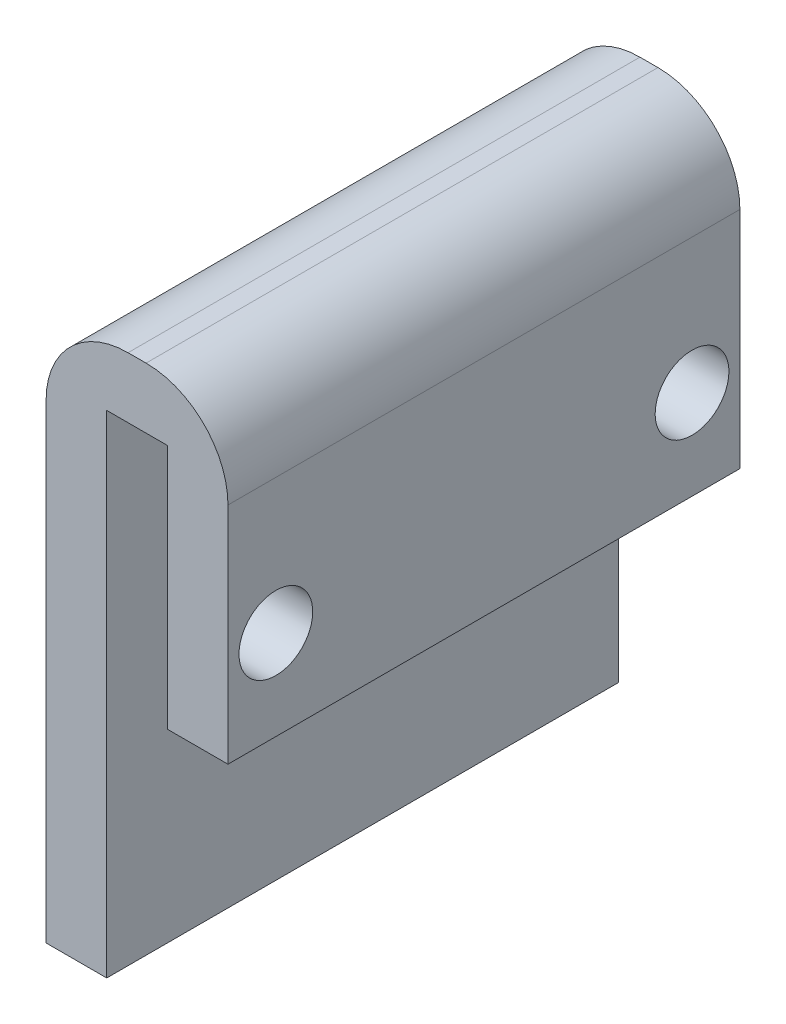
from build123d import *

# Parameters (mm, degrees)
BOSS_EXTRUDE1_DEPTH = 31.242
FILLET1_R           = 5
CUT_EXTRUDE1_REACH  = 49.275
SKETCH2_R           = 2.25


with BuildPart() as part:
    # Sketch1 → Boss-Extrude1 (new body)
    with BuildSketch(Plane.XY):
        Polygon((0, 0), (0, 30), (3.7, 30), (3.7, 15), (7.4, 15), (7.4, 33.7), (-3.7, 33.7), (-3.7, 0), align=None)
    extrude(amount=BOSS_EXTRUDE1_DEPTH)

    # Fillet1
    fillet1_edges = [part.edges().sort_by_distance(p)[0] for p in [
        (7.4, 33.7, 15.621),
        (-3.7, 33.7, 15.621),
    ]]
    fillet(fillet1_edges, radius=FILLET1_R)

    # Sketch2 → Cut-Extrude1 (cut, up to next)
    with BuildSketch(Plane(origin=(7.4, 0, 0), x_dir=(0, 0, -1), z_dir=(1, 0, 0)), mode=Mode.PRIVATE) as cut_extrude1_sk1:
        with Locations((-28.321, 20.475)):
            Circle(SKETCH2_R)
    cut_extrude1_tool1 = extrude(cut_extrude1_sk1.sketch, amount=-CUT_EXTRUDE1_REACH, mode=Mode.PRIVATE) & part.part
    # Sketch2 → Cut-Extrude1 (cut, up to next)
    with BuildSketch(Plane(origin=(7.4, 0, 0), x_dir=(0, 0, -1), z_dir=(1, 0, 0)), mode=Mode.PRIVATE) as cut_extrude1_sk2:
        with Locations((-2.921, 20.475)):
            Circle(SKETCH2_R)
    cut_extrude1_tool2 = extrude(cut_extrude1_sk2.sketch, amount=-CUT_EXTRUDE1_REACH, mode=Mode.PRIVATE) & part.part
    add(cut_extrude1_tool1.solids().sort_by_distance((7.4, 20.475, 28.321))[0], mode=Mode.SUBTRACT)
    add(cut_extrude1_tool2.solids().sort_by_distance((7.4, 20.475, 2.921))[0], mode=Mode.SUBTRACT)


solid = part.part
